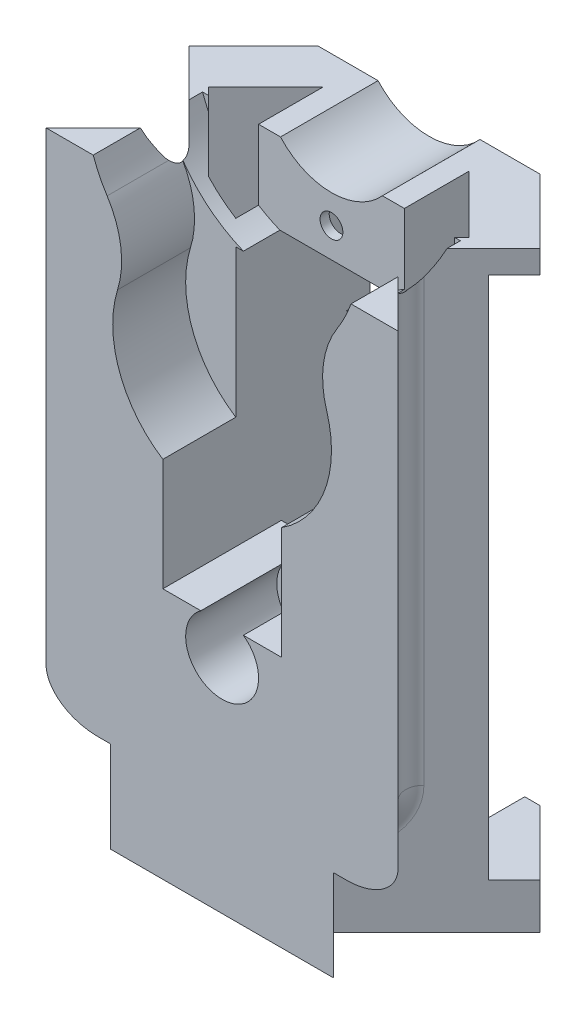
from build123d import *

# Parameters (mm, degrees)
EXTRUDE_1_DEPTH        = 65
CUT_EXTRUDE_1_DEPTH    = 57.5
SKETCH_4_R             = 1.25
SKETCH_4_W             = 13
SKETCH_4_H             = 28.5
CUT_EXTRUDE_2_DEPTH    = 13
SKETCH_9_W             = 13
SKETCH_9_H             = 38.4
CUT_EXTRUDE_6_DEPTH    = 75.806476324
CUT_EXTRUDE_7_DEPTH    = 18
SKETCH_13_W            = 21
SKETCH_13_H            = 5
CUT_EXTRUDE_10_DEPTH   = 18
CUT_EXTRUDE_8_DEPTH    = 78.086308123
CUT_EXTRUDE_9_DEPTH    = 10
FILLET_1_R             = 4
FILLET_1_OF_MIRROR_3_R = 4
SKETCH_21_W            = 21
SKETCH_21_H            = 14
CUT_EXTRUDE_17_DEPTH   = 8
SKETCH_17_W            = 19.798748342
SKETCH_17_H            = 9
CUT_EXTRUDE_13_DEPTH   = 3
SKETCH_18_W            = 14
SKETCH_18_H            = 18
CUT_EXTRUDE_14_DEPTH   = 5
SKETCH_19_R            = 4
CUT_EXTRUDE_15_DEPTH   = 10
FILLET_6_R             = 2
SKETCH_5_R             = 12
CUT_EXTRUDE_3_DEPTH    = 8
CUT_EXTRUDE_16_DEPTH   = 61.954985592
CUT_EXTRUDE_18_DEPTH   = 25
CUT_EXTRUDE_19_DEPTH   = 20
CUT_EXTRUDE_5_DEPTH    = 76.706738594
CUT_EXTRUDE_20_DEPTH   = 12
FILLET_5_R             = 10


with BuildPart() as part:
    # 草圖1 → 填料-伸長1 (new body)
    with BuildSketch(Plane(origin=(0, 0, 0), x_dir=(1, 0, 0), z_dir=(0, 1, 0))):
        Polygon((0, 0), (24.34, 0), (34.67, -10.33), (34.67, -22.7), (-10.33, -22.7), (-10.33, -10.33), align=None)
    extrude(amount=EXTRUDE_1_DEPTH)

    # 草圖2 → 除料-伸長1 (cut)
    with BuildSketch(Plane(origin=(0, 5, 0), x_dir=(1, 0, 0), z_dir=(0, 1, 0))):
        Polygon((0, 0), (-22.7, -22.7), (-17.043145751, -22.7), (5.656854249, 0), align=None)
    cut_extrude_1 = extrude(amount=CUT_EXTRUDE_1_DEPTH, mode=Mode.SUBTRACT)

    # 鏡射1: 除料-伸長1 across plane
    add(cut_extrude_1.mirror(Plane.ZY.offset(-12.17)), mode=Mode.SUBTRACT)

    # 草圖4 → 除料-伸長2 (cut)
    with BuildSketch(Plane.XY.offset(22.7)):
        with Locations((12.17, 59.36)):
            Circle(SKETCH_4_R)
        with Locations((12.17, 24.36)):
            Circle(SKETCH_4_R)
        with Locations((12.17, 41.86)):
            Rectangle(SKETCH_4_W, SKETCH_4_H)
    extrude(amount=-CUT_EXTRUDE_2_DEPTH, mode=Mode.SUBTRACT)

    # 草圖9 → 除料-伸長6 (cut, through all)
    with BuildSketch(Plane.XY.offset(9.7)):
        with Locations((12.17, 41.86)):
            Rectangle(SKETCH_9_W, SKETCH_9_H)
    extrude(amount=-CUT_EXTRUDE_6_DEPTH, mode=Mode.SUBTRACT)

    # 草圖10 → 除料-伸長7 (cut)
    with BuildSketch(Plane.XZ):
        Polygon((20.67, 3), (3.67, 3), (1.67, 5), (1.67, 10), (22.67, 10), (22.67, 5), align=None)
    extrude(amount=-CUT_EXTRUDE_7_DEPTH, mode=Mode.SUBTRACT)

    # 草圖13 → 除料-伸長10 (cut)
    with BuildSketch(Plane.XZ):
        with Locations((12.17, 12.5)):
            Rectangle(SKETCH_13_W, SKETCH_13_H)
    extrude(amount=-CUT_EXTRUDE_10_DEPTH, mode=Mode.SUBTRACT)

    # 草圖11 → 除料-伸長8 (cut, through all)
    with BuildSketch(Plane.XZ):
        Polygon((-9.55794071, 4.584194914), (-25.114289896, 20.1405441), (-14.849242405, 30.405591591), (0.707106781, 14.849242405), align=None)
    cut_extrude_8 = extrude(amount=-CUT_EXTRUDE_8_DEPTH, mode=Mode.SUBTRACT)

    # 草圖12 → 除料-伸長9 (cut)
    with BuildSketch(Plane.XZ):
        Polygon((-4.242640687, 9.899494937), (-19.798989873, 25.455844123), (-11.313708499, 33.941125497), (4.242640687, 18.384776311), align=None)
    cut_extrude_9 = extrude(amount=-CUT_EXTRUDE_9_DEPTH, mode=Mode.SUBTRACT)

    # 圓角1
    fillet_1_edges = [part.edges().sort_by_distance(p)[0] for p in [
        (-3.218272016, 10, 18.774621202),
    ]]
    fillet(fillet_1_edges, radius=FILLET_1_R)

    # 鏡射3: 除料-伸長8, 除料-伸長9 across plane
    add(cut_extrude_8.mirror(Plane.ZY.offset(-12.17)), mode=Mode.SUBTRACT)
    add(cut_extrude_9.mirror(Plane.ZY.offset(-12.17)), mode=Mode.SUBTRACT)

    # 圓角1 of 鏡射3
    fillet_1_of_mirror_3_edges = [part.edges().sort_by_distance(p)[0] for p in [
        (27.558272016, 10, 18.774621202),
    ]]
    fillet(fillet_1_of_mirror_3_edges, radius=FILLET_1_OF_MIRROR_3_R)

    # 草圖21 → 除料-伸長17 (cut)
    with BuildSketch(Plane(origin=(0, 0, 0), x_dir=(-1, 0, 0), z_dir=(0, 0, -1))):
        with Locations((-12.17, 7)):
            Rectangle(SKETCH_21_W, SKETCH_21_H)
    extrude(amount=-CUT_EXTRUDE_17_DEPTH, mode=Mode.SUBTRACT)

    # 草圖17 → 除料-伸長13 (cut)
    with BuildSketch(Plane(origin=(2.828427125, 0, 2.828427125), x_dir=(-0.7071067811865472, 0, 0.7071067811865479), z_dir=(-0.7071067811865479, 0, -0.7071067811865472))):
        with Locations((11.537637522, 9.5)):
            Rectangle(SKETCH_17_W, SKETCH_17_H)
    extrude(amount=-CUT_EXTRUDE_13_DEPTH, mode=Mode.SUBTRACT)

    # 草圖18 → 除料-伸長14 (cut)
    with BuildSketch(Plane.XY.offset(15)):
        with Locations((12.17, 9)):
            Rectangle(SKETCH_18_W, SKETCH_18_H)
    extrude(amount=CUT_EXTRUDE_14_DEPTH, mode=Mode.SUBTRACT)

    # 草圖19 → 除料-伸長15 (cut)
    with BuildSketch(Plane.XY.offset(22.7)):
        with Locations((12.17, 24.36)):
            Circle(SKETCH_19_R)
    extrude(amount=-CUT_EXTRUDE_15_DEPTH, mode=Mode.SUBTRACT)

    # 圓角6
    fillet_6_edges = [part.edges().sort_by_distance(p)[0] for p in [
        (0.707106781, 39.5, 14.849242405),
        (3.889087297, 10, 18.03122292),
        (1.535533906, 11.171572875, 15.67766953),
        (23.632893219, 39.5, 14.849242405),
        (20.450912703, 10, 18.03122292),
        (22.804466094, 11.171572875, 15.67766953),
    ]]
    fillet(fillet_6_edges, radius=FILLET_6_R)

    # 草圖5 → 除料-伸長3 (cut)
    with BuildSketch(Plane.XY.offset(22.7)):
        with Locations((12.17, 50)):
            Circle(SKETCH_5_R)
    extrude(amount=-CUT_EXTRUDE_3_DEPTH, mode=Mode.SUBTRACT)

    # 草圖20 → 除料-伸長16 (cut, through all)
    with BuildSketch(Plane.XZ.offset(-18)):
        Polygon((4.17, 3.608174593), (-2.121320344, 9.899494937), (1.17918472, 13.2), (4.17, 13.2), align=None)
        Polygon((20.17, 13.2), (23.16081528, 13.2), (26.461320344, 9.899494937), (20.17, 3.608174593), align=None)
    extrude(amount=-CUT_EXTRUDE_16_DEPTH, mode=Mode.SUBTRACT)

    # 草圖22 → 除料-伸長18 (cut)
    with BuildSketch(Plane.XZ.offset(-14)):
        Polygon((1.414213562, 16.263455967), (-3.52233047, 21.2), (3.67, 21.2), (3.67, 18.519242405), align=None)
        Polygon((27.86233047, 21.2), (20.67, 21.2), (20.67, 18.519242405), (22.925786438, 16.263455967), align=None)
    extrude(amount=-CUT_EXTRUDE_18_DEPTH, mode=Mode.SUBTRACT)

    # 草圖23 → 除料-伸長19 (cut)
    with BuildSketch(Plane.XZ.offset(-18)):
        Polygon((4.17, 13.2), (1.17918472, 13.2), (4.17, 16.19081528), align=None)
        Polygon((23.16081528, 13.2), (20.17, 16.19081528), (20.17, 13.2), align=None)
    extrude(amount=-CUT_EXTRUDE_19_DEPTH, mode=Mode.SUBTRACT)

    # 草圖8 → 除料-伸長5 (cut, through all)
    with BuildSketch(Plane.XY.offset(22.7)):
        with BuildLine():
            Line((4.67, 70), (4.67, 73.83732793))
            Line((4.67, 73.83732793), (19.67, 73.83732793))
            Line((19.67, 73.83732793), (19.67, 70))
            ThreePointArc((19.67, 70), (12.17, 62.5), (4.67, 70))
        make_face()
    extrude(amount=-CUT_EXTRUDE_5_DEPTH, mode=Mode.SUBTRACT)

    # 草圖7 → 除料-伸長20 (cut)
    with BuildSketch(Plane.XY.offset(22.7)):
        with BuildLine():
            Line((-2.83, 70), (27.17, 70))
            ThreePointArc((27.17, 70), (12.17, 55), (-2.83, 70))
        make_face()
    extrude(amount=-CUT_EXTRUDE_20_DEPTH, mode=Mode.SUBTRACT)

    # 圓角5
    # the kernel refuses this fillet: 10 mm, written as the material it takes off along each edge
    with BuildSketch(Plane(origin=(3.203430143, 57.975, 14.7), x_dir=(-0.6822618553726185, 0.7311078994946726, 0), z_dir=(0, 0, 1))) as fillet_5_piece_1:
        with BuildLine():
            CenterArc((7.130730412, 9.839819243), FILLET_5_R, 209.862696675, 49.868396236)
            ThreePointArc((-1.541480723, 4.86058697), (-0.50958274, 2.5131167), (0, 0))
            ThreePointArc((0, 0), (2.674023904, 0.240271135), (5.348047809, 0))
        make_face()
    extrude(amount=21.370119522, mode=Mode.SUBTRACT)
    with BuildSketch(Plane(origin=(21.136569857, 57.975, 14.7), x_dir=(0.490653030896535, -0.8713550385876264, 0), z_dir=(0, 0, 1))) as fillet_5_piece_2:
        with BuildLine():
            CenterArc((7.223814974, 9.771686454), FILLET_5_R, 207.864748404, 49.868396236)
            ThreePointArc((-1.616718622, 5.097826622), (-0.579329834, 2.621547444), (0, 0))
            ThreePointArc((0, 0), (2.549581756, 0.273976255), (5.099163511, 0))
        make_face()
    extrude(amount=21.370119522, mode=Mode.SUBTRACT)


solid = part.part
